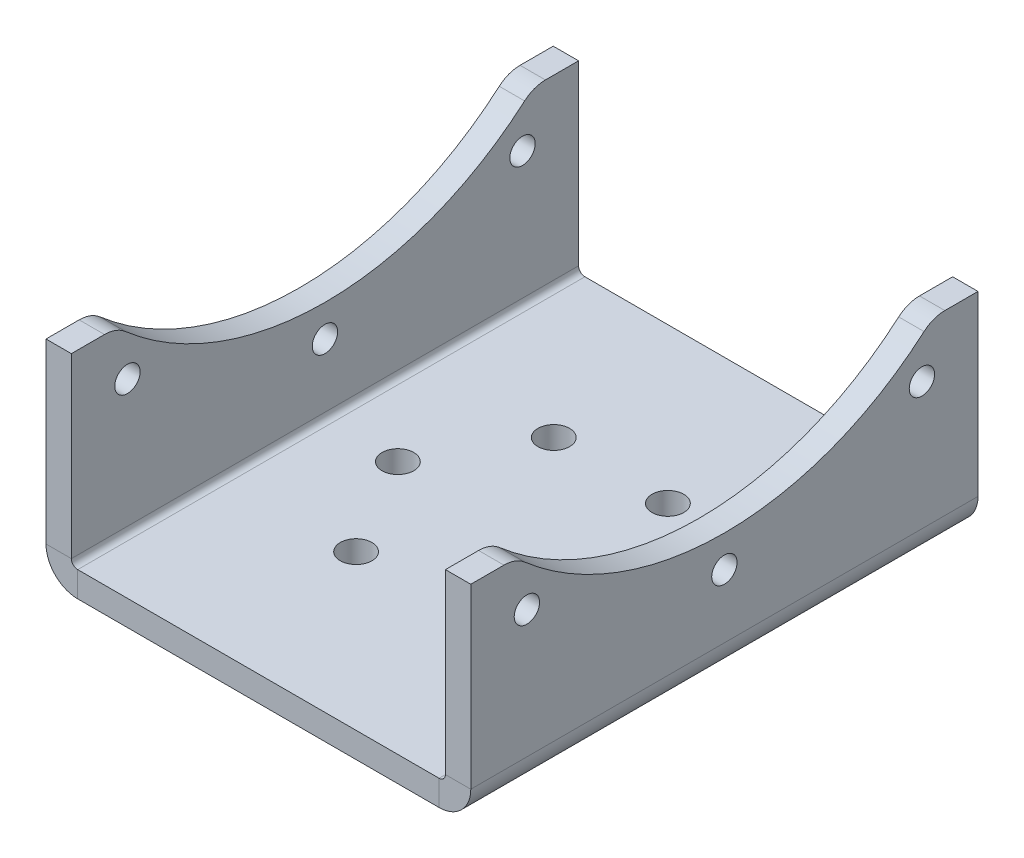
from build123d import *

# Parameters (mm, degrees)
SM_BASE_FLANGE_1_DEPTH   = 80
CUT_EXTRUDE_3_DEPTH      = 109.305124532
CUT_EXTRUDE_3_DEPTH_BACK = 109.305124532
SKETCH_6_R               = 48
SKETCH_6_R_2             = 2
FILLET_1_R               = 5
SKETCH_9_R               = 2.5
CUT_EXTRUDE_4_DEPTH      = 93.796821066


# Sheet-metal steps are written as plain solids
with BuildPart() as part:
    # Sketch 1 → Базовая кромка1 (new body)
    with BuildSketch(Plane.XY):
        with BuildLine():
            Line((-29.5, 29), (-29.5, 1))
            ThreePointArc((-29.5, 1), (-29.207106781, 0.292893219), (-28.5, 0))
            Line((-28.5, 0), (28.5, 0))
            ThreePointArc((28.5, 0), (29.207106781, 0.292893219), (29.5, 1))
            Line((29.5, 1), (29.5, 29))
            Line((29.5, 29), (33.5, 29))
            Line((33.5, 29), (33.5, 1))
            ThreePointArc((33.5, 1), (32.035533906, -2.535533906), (28.5, -4))
            Line((28.5, -4), (-28.5, -4))
            ThreePointArc((-28.5, -4), (-32.035533906, -2.535533906), (-33.5, 1))
            Line((-33.5, 1), (-33.5, 29))
            Line((-33.5, 29), (-29.5, 29))
        make_face()
    extrude(amount=SM_BASE_FLANGE_1_DEPTH)

    # Эскиз6 → Вырез-Вытянуть3 (cut, two sides: drawn at the far end of the back side and taken through both)
    with BuildSketch(Plane.ZY.offset(33.5).offset(-CUT_EXTRUDE_3_DEPTH_BACK)):
        with Locations((40, 64)):
            Circle(SKETCH_6_R)
        with Locations((40, 11)):
            Circle(SKETCH_6_R_2)
        with Locations((8.847381628, 21.122099298)):
            Circle(SKETCH_6_R_2)
        with Locations((71.152618372, 21.122099298)):
            Circle(SKETCH_6_R_2)
    extrude(amount=CUT_EXTRUDE_3_DEPTH + CUT_EXTRUDE_3_DEPTH_BACK, mode=Mode.SUBTRACT)

    # Скругление1
    fillet_1_edges = [part.edges().sort_by_distance(p)[0] for p in [
        (31.5, 29, 7.151864589),
        (31.5, 29, 72.848135411),
        (-31.5, 29, 7.151864589),
        (-31.5, 29, 72.848135411),
    ]]
    fillet(fillet_1_edges, radius=FILLET_1_R)

    # Эскиз9 → Вырез-Вытянуть4 (cut, through all)
    with BuildSketch(Plane.XZ.offset(4)):
        with Locations((18, 40)):
            Circle(SKETCH_9_R)
        with Locations((9, 24.411542732)):
            Circle(SKETCH_9_R)
        with Locations((-9, 24.411542732)):
            Circle(SKETCH_9_R)
        with Locations((-18, 40)):
            Circle(SKETCH_9_R)
        with Locations((-9, 55.588457268)):
            Circle(SKETCH_9_R)
        with Locations((9, 55.588457268)):
            Circle(SKETCH_9_R)
    extrude(amount=-CUT_EXTRUDE_4_DEPTH, mode=Mode.SUBTRACT)


solid = part.part
